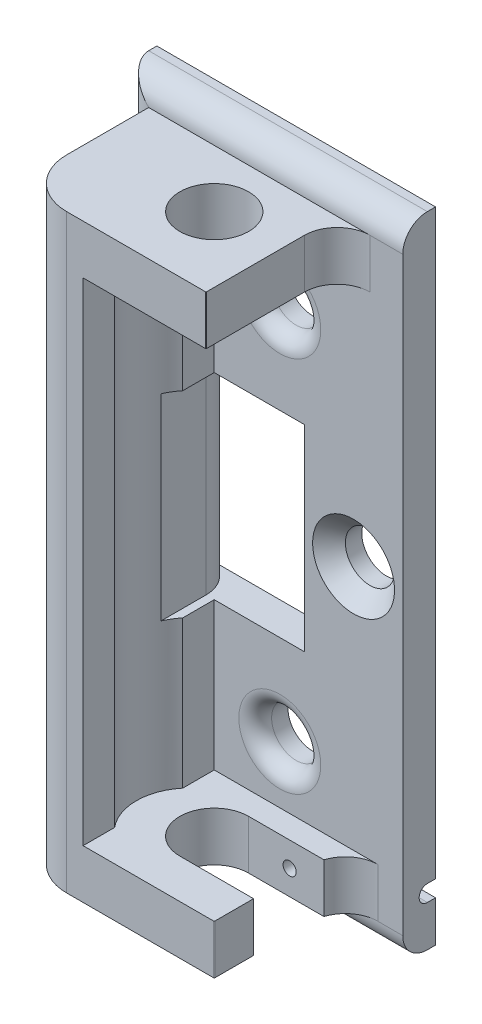
from build123d import *

# Parameters (mm, degrees)
ESQUISSE1_W                  = 17
ESQUISSE1_H                  = 39
BOSS_EXTRU_1_DEPTH           = 2
ESQUISSE2_W                  = 8
ESQUISSE2_H                  = 3
ESQUISSE2_W_2                = 9
BOSS_EXTRU_2_DEPTH           = 8
ESQUISSE3_R                  = 2.1
ENL_V_MAT_EXTRU_1_DEPTH      = 43.367037979
CONG_1_R                     = 0.0326
ESQUISSE14_W                 = 4
ESQUISSE14_H                 = 35.996211904
BOSS_EXTRU_8_DEPTH           = 8
ENL_V_MAT_EXTRU_2_DEPTH      = 3
ENL_V_MAT_EXTRU_2_DEPTH_BACK = 44.289721644
ESQUISSE4_W                  = 6
ESQUISSE4_H                  = 12
ENL_V_START                  = -3
ESQUISSE15_R                 = 3.25
ENL_V_MAT_EXTRU_7_DEPTH      = 29.95
CONG_9_R                     = 3
CONG_10_R                    = 2
CONG_11_R                    = 2
CONG_12_R                    = 1.5
ESQUISSE16_R                 = 1
ENL_V_MAT_EXTRU_8_DEPTH      = 8
ENL_V_MAT_EXTRU_9_REACH      = 44.367
ESQUISSE17_W                 = 6.298788147
ESQUISSE17_H                 = 4.2
ENL_V_START_2                = -0.5
ESQUISSE18_R                 = 0.4
ENL_V_MAT_EXTRU_10_DEPTH     = 10
ENL_V_MAT_EXTRU_18_DEPTH     = 7
ESQUISSE21_R                 = 1.5
ENL_V_MAT_EXTRU_19_DEPTH     = 44.289721683
CHANFREIN1_SIZE              = 1
ENL_V_MAT_EXTRU_20_REACH     = 45.29
ESQUISSE22_R                 = 1.5
CONG_14_R                    = 1


with BuildPart() as part:
    # Esquisse1 → Boss.-Extru.1 (new body)
    with BuildSketch(Plane.XY):
        with Locations((8.5, 19.5)):
            Rectangle(ESQUISSE1_W, ESQUISSE1_H)
    extrude(amount=BOSS_EXTRU_1_DEPTH)

    # Esquisse2 → Boss.-Extru.2 (add)
    with BuildSketch(Plane.XY.offset(2)):
        with Locations((9, 36)):
            Rectangle(ESQUISSE2_W, ESQUISSE2_H)
        with Locations((9, 3.003788096)):
            Rectangle(ESQUISSE2_W_2, ESQUISSE2_H)
    extrude(amount=BOSS_EXTRU_2_DEPTH)

    # Esquisse3 → Enlèv. mat.-Extru.1 (cut, through all)
    with BuildSketch(Plane.XZ.offset(-1.503788096)):
        with Locations(Location((9, 5.5, 0), (0, 0, 270))):
            Circle(ESQUISSE3_R)
    extrude(amount=-ENL_V_MAT_EXTRU_1_DEPTH, mode=Mode.SUBTRACT)

    # Congé1
    cong_1_edges = [part.edges().sort_by_distance(p)[0] for p in [
        (13, 36, 10),
        (13.5, 3.003788096, 10),
    ]]
    fillet(cong_1_edges, radius=CONG_1_R)

    # Esquisse14 → Boss.-Extru.8 (add)
    with BuildSketch(Plane.XY.offset(2)):
        with Locations((3.5, 19.501894048)):
            Rectangle(ESQUISSE14_W, ESQUISSE14_H)
    extrude(amount=BOSS_EXTRU_8_DEPTH)

    # Esquisse4 → Enlèv. mat.-Extru.2 (cut, two sides: drawn at the far end of the back side and taken through both)
    with BuildSketch(Plane.XY.offset(2).offset(-ENL_V_MAT_EXTRU_2_DEPTH_BACK)):
        with Locations((8, 19.5)):
            Rectangle(ESQUISSE4_W, ESQUISSE4_H)
    extrude(amount=ENL_V_MAT_EXTRU_2_DEPTH + ENL_V_MAT_EXTRU_2_DEPTH_BACK, mode=Mode.SUBTRACT)

    # Esquisse15 → Enlèv. mat.-Extru.7 (cut)
    with BuildSketch(Plane.XZ.offset(-1.503788096).offset(ENL_V_START)):
        with Locations((8, 6)):
            Circle(ESQUISSE15_R)
    extrude(amount=-ENL_V_MAT_EXTRU_7_DEPTH, mode=Mode.SUBTRACT)

    # Congé9
    cong_9_edges = [part.edges().sort_by_distance(p)[0] for p in [
        (1.5, 19.501894048, 10),
    ]]
    fillet(cong_9_edges, radius=CONG_9_R)

    # Congé10
    cong_10_edges = [part.edges().sort_by_distance(p)[0] for p in [
        (5, 19.5, 0),
    ]]
    fillet(cong_10_edges, radius=CONG_10_R)

    # Congé11
    cong_11_edges = [part.edges().sort_by_distance(p)[0] for p in [
        (13, 36, 2),
        (13.5, 3.003788096, 2),
    ]]
    fillet(cong_11_edges, radius=CONG_11_R)

    # Congé12
    cong_12_edges = [part.edges().sort_by_distance(p)[0] for p in [
        (8.5, 39, 2),
        (0, 19.5, 2),
        (8.5, 0, 2),
    ]]
    fillet(cong_12_edges, radius=CONG_12_R - 0.0001)  # a hair under: the kernel refuses the full size

    # Esquisse16 → Enlèv. mat.-Extru.8 (cut)
    with BuildSketch(Plane(origin=(0, 0, 0), x_dir=(-1, 0, 0), z_dir=(0, 0, -1))):
        with Locations((-3.5, 35.5)):
            Circle(ESQUISSE16_R)
        with Locations((-3.5, 3.5)):
            Circle(ESQUISSE16_R)
    extrude(amount=-ENL_V_MAT_EXTRU_8_DEPTH, mode=Mode.SUBTRACT)

    # Esquisse17 → Enlèv. mat.-Extru.9 (cut, up to next)
    with BuildSketch(Plane.XZ.offset(-1.503788096), mode=Mode.PRIVATE) as enl_v_mat_extru_9_sk1:
        with Locations((12.149394074, 5.5)):
            Rectangle(ESQUISSE17_W, ESQUISSE17_H)
    enl_v_mat_extru_9_tool1 = extrude(enl_v_mat_extru_9_sk1.sketch, amount=-ENL_V_MAT_EXTRU_9_REACH, mode=Mode.PRIVATE) & part.part
    add(enl_v_mat_extru_9_tool1.solids().sort_by_distance((12.149394, 1.503788, 5.5))[0], mode=Mode.SUBTRACT)

    # Esquisse18 → Enlèv. mat.-Extru.10 (cut)
    with BuildSketch(Plane.XY.offset(10).offset(ENL_V_START_2)):
        with Locations((11.5, 3.003788096)):
            Circle(ESQUISSE18_R)
    extrude(amount=-ENL_V_MAT_EXTRU_10_DEPTH, mode=Mode.SUBTRACT)

    # Esquisse20 → Enlèv. mat.-Extru.18 (cut)
    with BuildSketch(Plane(origin=(17, 0, 0), x_dir=(0, 0, -1), z_dir=(1, 0, 0))):
        with BuildLine():
            Line((-0.5, 3.503788096), (1.040895872, 3.503788096))
            ThreePointArc((1.040895872, 3.503788096), (1.540895872, 3.003788096), (1.040895872, 2.503788096))
            Line((1.040895872, 2.503788096), (-0.5, 2.503788096))
            ThreePointArc((-0.5, 2.503788096), (-1, 3.003788096), (-0.5, 3.503788096))
        make_face()
    extrude(amount=-ENL_V_MAT_EXTRU_18_DEPTH, mode=Mode.SUBTRACT)

    # Esquisse21 → Enlèv. mat.-Extru.19 (cut, through all)
    with BuildSketch(Plane.XY.offset(2)):
        with Locations((14, 19.5)):
            Circle(ESQUISSE21_R)
    extrude(amount=-ENL_V_MAT_EXTRU_19_DEPTH, mode=Mode.SUBTRACT)

    # Chanfrein1
    chanfrein1_edges = [part.edges().sort_by_distance(p)[0] for p in [
        (12.5, 19.5, 2),
    ]]
    chamfer(chanfrein1_edges, length=CHANFREIN1_SIZE)

    # Esquisse22 → Enlèv. mat.-Extru.20 (cut, up to next)
    with BuildSketch(Plane.XY.offset(2), mode=Mode.PRIVATE) as enl_v_mat_extru_20_sk1:
        with Locations((9.5, 31)):
            Circle(ESQUISSE22_R)
    enl_v_mat_extru_20_tool1 = extrude(enl_v_mat_extru_20_sk1.sketch, amount=-ENL_V_MAT_EXTRU_20_REACH, mode=Mode.PRIVATE) & part.part
    # Esquisse22 → Enlèv. mat.-Extru.20 (cut, up to next)
    with BuildSketch(Plane.XY.offset(2), mode=Mode.PRIVATE) as enl_v_mat_extru_20_sk2:
        with Locations((9.5, 8.003788096)):
            Circle(ESQUISSE22_R)
    enl_v_mat_extru_20_tool2 = extrude(enl_v_mat_extru_20_sk2.sketch, amount=-ENL_V_MAT_EXTRU_20_REACH, mode=Mode.PRIVATE) & part.part
    add(enl_v_mat_extru_20_tool1.solids().sort_by_distance((9.5, 31, 2))[0], mode=Mode.SUBTRACT)
    add(enl_v_mat_extru_20_tool2.solids().sort_by_distance((9.5, 8.003788, 2))[0], mode=Mode.SUBTRACT)

    # Congé14
    cong_14_edges = [part.edges().sort_by_distance(p)[0] for p in [
        (8, 31, 2),
        (8, 8.003788096, 2),
    ]]
    fillet(cong_14_edges, radius=CONG_14_R)


solid = part.part
